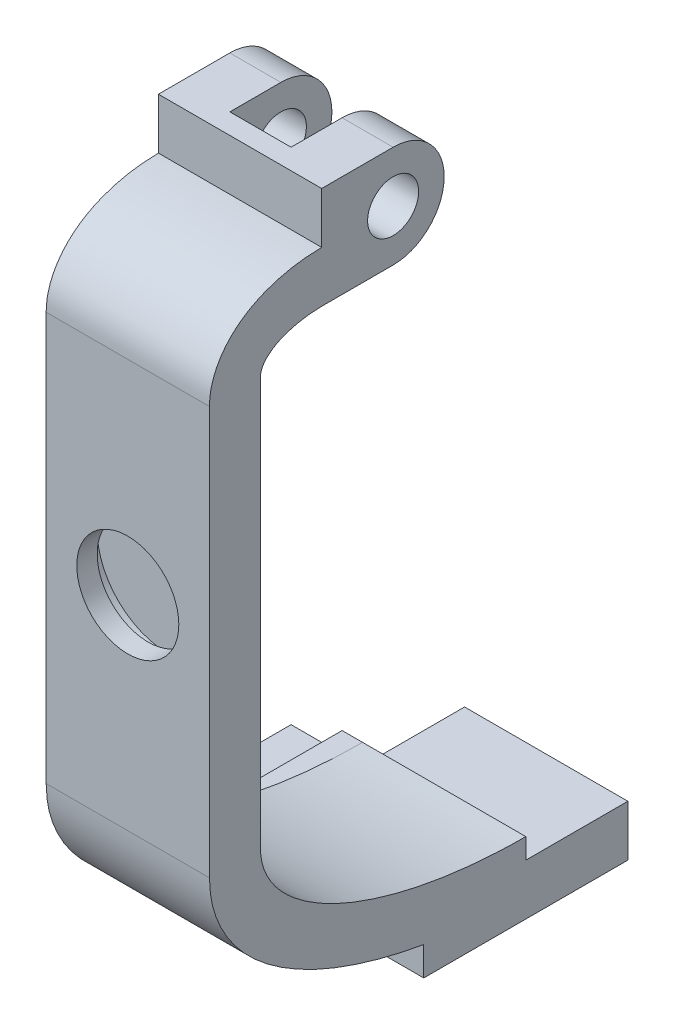
from build123d import *

# Parameters (mm, degrees)
BOSS_EXTRUDE2_DEPTH     = 10
CUT_EXTRUDE1_DEPTH      = 20.104973175
CUT_EXTRUDE1_DEPTH_BACK = 20.104973175
SKETCH3_R               = 2.5
SWEEP2_DEPTH            = 16
SKETCH6_W               = 16
SKETCH6_H               = 5
BOSS_EXTRUDE3_DEPTH     = 40
SWEEP4_DEPTH            = 16
SKETCH11_R              = 5
CUT_EXTRUDE2_DEPTH      = 2
SKETCH13_R              = 7
CUT_EXTRUDE3_DEPTH      = 2
BOSS_EXTRUDE6_START     = -2
BOSS_EXTRUDE6_DEPTH     = 5
SKETCH14_R              = 5
CUT_EXTRUDE4_DEPTH      = 2
SKETCH15_R              = 7
CUT_EXTRUDE5_DEPTH      = 2
SKETCH17_W              = 12
SKETCH17_H              = 5
BOSS_EXTRUDE8_DEPTH     = 2
SKETCH18_W              = 8
SKETCH18_H              = 3
BOSS_EXTRUDE9_DEPTH     = 5
FILLET1_R               = 5


# Read off the part's stored shape, not the designer's step: Sweep2, Sweep4
with BuildPart() as part:
    # Sketch1 → Boss-Extrude2 (new body)
    with BuildSketch(Plane(origin=(0, 0, 0), x_dir=(1, 0, 0), z_dir=(0, 1, 0))):
        Polygon((16, 0), (11, 0), (11, -10), (5, -10), (5, 0), (0, 0), (0, -12), (16, -12), align=None)
    extrude(amount=BOSS_EXTRUDE2_DEPTH)

    # Sketch3 → Cut-Extrude1 (cut, two sides: drawn at the far end of the back side and taken through both)
    with BuildSketch(Plane(origin=(5, 0, 0), x_dir=(0, 0, -1), z_dir=(1, 0, 0)).offset(-CUT_EXTRUDE1_DEPTH_BACK)):
        with Locations((-5, 5)):
            Circle(SKETCH3_R)
    extrude(amount=CUT_EXTRUDE1_DEPTH + CUT_EXTRUDE1_DEPTH_BACK, mode=Mode.SUBTRACT)

    # Sweep2 outline → Sweep2 (add)
    with BuildSketch(Plane.YZ):
        with BuildLine():
            Line((0, 12), (5, 12))
            add(Edge.make_bspline(
                [(5, 12), (4.991277814, 12.688318981), (4.908746061, 14.118877097), (4.494059835, 16.245318685), (3.957732254, 17.750342889), (3.411318321, 18.842891552), (3.001489478, 19.557726126), (2.242511991, 20.561874881), (1.580556332, 21.203692416), (0.928716087, 21.720024552), (0.323591986, 22.133748121), (-0.701392406, 22.614526195), (-1.823238843, 22.935468381), (-2.608908218, 22.983859145), (-3, 23)],
                knots=[0, 0, 0, 0, 0.166666667, 0.333333333, 0.5, 0.5, 0.583333333, 0.666666667, 0.75, 0.75, 0.8125, 0.875, 0.9375, 1, 1, 1, 1], degree=3))
            Line((-3, 23), (-3, 18))
            add(Edge.make_bspline(
                [(0, 12), (0, 12.471404521), (-0.065087382, 13.468133715), (-0.357980601, 14.963227506), (-0.683417511, 15.852116395), (-0.976310729, 16.437902833), (-1.185341525, 16.80000901), (-1.529633622, 17.249552677), (-1.772618921, 17.481263886), (-1.988038584, 17.651829247), (-2.174202639, 17.777587461), (-2.454251279, 17.908151493), (-2.731349145, 17.983890946), (-2.911611652, 18), (-3, 18)],
                knots=[0, 0, 0, 0, 0.166666667, 0.333333333, 0.5, 0.5, 0.583333333, 0.666666667, 0.75, 0.75, 0.8125, 0.875, 0.9375, 1, 1, 1, 1], degree=3))
        make_face()
    extrude(amount=SWEEP2_DEPTH)

    # Sketch6 → Boss-Extrude3 (add)
    with BuildSketch(Plane.XZ.offset(3)):
        with Locations((8, 20.5)):
            Rectangle(SKETCH6_W, SKETCH6_H)
    extrude(amount=BOSS_EXTRUDE3_DEPTH)

    # Sweep4 outline → Sweep4 (add)
    with BuildSketch(Plane.YZ):
        with BuildLine():
            add(Edge.make_bspline(
                [(-43, 18), (-43.353553391, 18), (-44.07460342, 17.930194099), (-45.182994884, 17.601989805), (-46.303189443, 17.036212331), (-47.047845664, 16.491260068), (-47.909524316, 15.752143507), (-48.881465514, 14.748061599), (-50.258633898, 12.800039043), (-51.094757082, 11.230912276), (-52.266329958, 8.69250438), (-53.267394144, 5.796111577), (-53.962527772, 2.637302685), (-54.352391453, 0.503622212), (-54.828170089, -2.731995713), (-55, -5.957247077), (-55, -8)],
                knots=[0, 0, 0, 0, 0.0625, 0.125, 0.1875, 0.25, 0.25, 0.333333333, 0.416666667, 0.5, 0.5, 0.666666667, 0.75, 0.75, 0.833333333, 1, 1, 1, 1], degree=3))
            Line((-43, 18), (-43, 23))
            add(Edge.make_bspline(
                [(-43, 23), (-43.681450726, 22.980975055), (-45.058295426, 22.873119263), (-47.066050979, 22.260765234), (-48.956424122, 21.301498195), (-50.119260314, 20.44421056), (-51.410038967, 19.336819996), (-52.782815769, 17.905936964), (-54.54234243, 15.403608104), (-55.559709648, 13.48696901), (-56.955815594, 10.466263575), (-58.086746894, 7.16551514), (-58.86004663, 3.650567343), (-59.291844345, 1.290053693), (-59.815258978, -2.269924856), (-59.994835555, -5.772418734), (-60, -8)],
                knots=[0, 0, 0, 0, 0.0625, 0.125, 0.1875, 0.25, 0.25, 0.333333333, 0.416666667, 0.5, 0.5, 0.666666667, 0.75, 0.75, 0.833333333, 1, 1, 1, 1], degree=3))
            Line((-60, -8), (-55, -8))
        make_face()
    extrude(amount=SWEEP4_DEPTH)

    # Sketch11 → Cut-Extrude2 (cut)
    with BuildSketch(Plane.XY.offset(23)):
        with Locations((8, -23)):
            Circle(SKETCH11_R)
    extrude(amount=-CUT_EXTRUDE2_DEPTH, mode=Mode.SUBTRACT)

    # Sketch13 → Cut-Extrude3 (cut)
    with BuildSketch(Plane.XY.offset(21)):
        with Locations((8, -23)):
            Circle(SKETCH13_R)
    extrude(amount=-CUT_EXTRUDE3_DEPTH, mode=Mode.SUBTRACT)

    # 3DSketch1 → Boss-Extrude6 (add)
    with BuildSketch(Plane(origin=(0, -60, -8), x_dir=(0.8479983040050881, 0, 0.52999894000318), z_dir=(0, 1, 0)).offset(BOSS_EXTRUDE6_START)):
        Polygon((0, 0), (13.567972864, 8.47998304), (18.867962264, 0), (5.2999894, -8.47998304), align=None)
    boss_extrude6 = extrude(amount=BOSS_EXTRUDE6_DEPTH)

    # Mirror1: Boss-Extrude6 across plane
    add(boss_extrude6.mirror(Plane(origin=(0, -37, -8), x_dir=(1, 0, 0), z_dir=(0, 0, 1))))

    # Sketch14 → Cut-Extrude4 (cut)
    with BuildSketch(Plane.XZ.offset(62)):
        with Locations(Location((8, -8, 0), (0, 0, 270))):
            Circle(SKETCH14_R)
    extrude(amount=-CUT_EXTRUDE4_DEPTH, mode=Mode.SUBTRACT)

    # Sketch15 → Cut-Extrude5 (cut)
    with BuildSketch(Plane.XZ.offset(60)):
        with Locations(Location((8, -8, 0), (0, 0, 270))):
            Circle(SKETCH15_R)
    extrude(amount=-CUT_EXTRUDE5_DEPTH, mode=Mode.SUBTRACT)

    # Sketch17 → Boss-Extrude8 (add)
    with BuildSketch(Plane.ZY):
        with Locations((-2, -57.5)):
            Rectangle(SKETCH17_W, SKETCH17_H)
    extrude(amount=BOSS_EXTRUDE8_DEPTH)

    # Sketch18 → Boss-Extrude9 (add)
    with BuildSketch(Plane.ZY.offset(2)):
        with Locations((-4, -58.5)):
            Rectangle(SKETCH18_W, SKETCH18_H)
    extrude(amount=BOSS_EXTRUDE9_DEPTH)

    # Fillet1
    fillet1_edges = [part.edges().sort_by_distance(p)[0] for p in [
        (13.5, 10, 0),
        (13.5, 0, 0),
        (2.5, 0, 0),
        (2.5, 10, 0),
    ]]
    fillet(fillet1_edges, radius=FILLET1_R - 0.0001)  # a hair under: the kernel refuses the full size


solid = part.part
